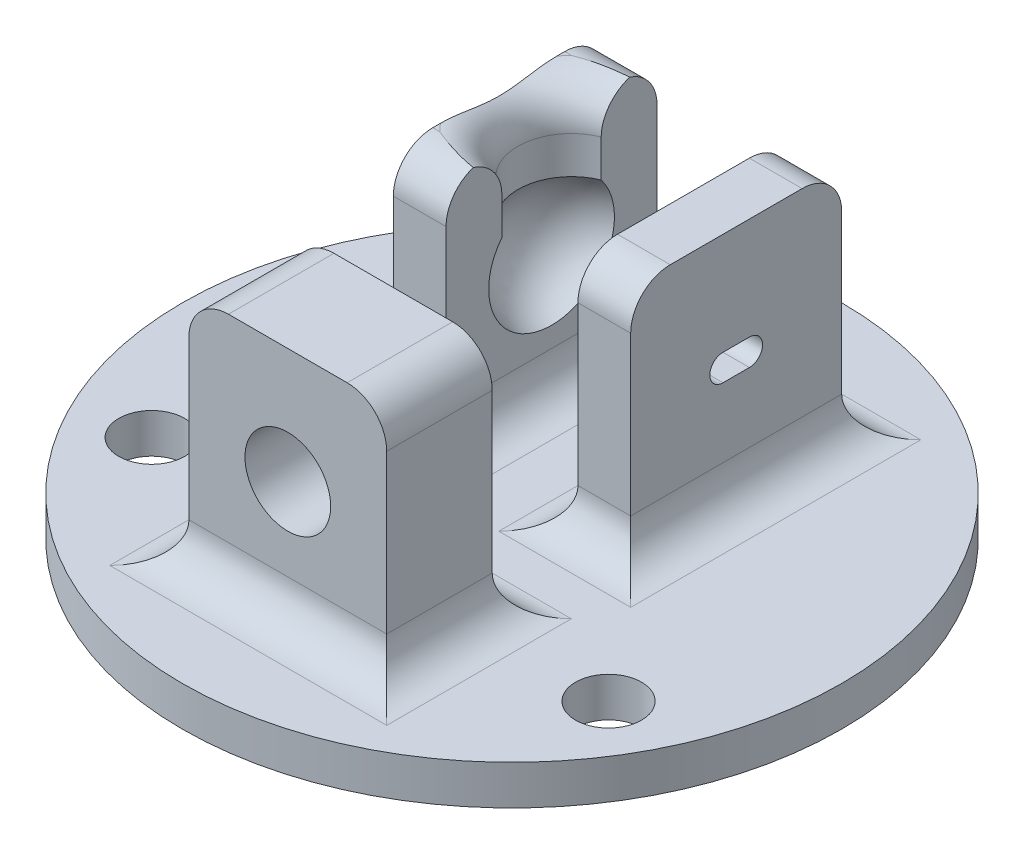
from build123d import *

# Parameters (mm, degrees)
BOSS_EXTRUDE1_DEPTH      = 2
BOSS_EXTRUDE1_DEPTH_BACK = 1
SKETCH1_R                = 25
SKETCH1_R_2              = 2.5
SKETCH2_W                = 4
SKETCH2_H                = 16
BOSS_EXTRUDE2_DEPTH      = 18
SKETCH3_R                = 5.75
CUT_EXTRUDE1_DEPTH       = 1.5
CUT_REVOLVE1_ANGLE       = 180
CUT_EXTRUDE2_REACH       = 43.122
CUT_EXTRUDE3_REACH       = 46.914
FILLET1_R                = 3
SKETCH7_W                = 15
SKETCH7_H                = 8
BOSS_EXTRUDE3_DEPTH      = 18
CUT_EXTRUDE4_REACH       = 54.811
SKETCH8_R                = 3.25
BOSS_EXTRUDE4_START      = -1
SKETCH9_R                = 3.25
SKETCH9_R_2              = 2.25
BOSS_EXTRUDE4_DEPTH      = 1
FILLET2_R                = 3


with BuildPart() as part:
    # Sketch1 → Boss-Extrude1 (new, two sides: drawn at the far end of the back side and taken through both)
    with BuildSketch(Plane(origin=(0, 0, 0), x_dir=(1, 0, 0), z_dir=(0, 1, 0)).offset(-BOSS_EXTRUDE1_DEPTH_BACK)):
        with Locations(Location((0, 0, 0), (0, 0, 270))):
            Circle(SKETCH1_R)
        with Locations(Location((0, 20, 0), (0, 0, 270))):
            Circle(SKETCH1_R_2, mode=Mode.SUBTRACT)
        with Locations(Location((17.320508076, -10, 0), (0, 0, 270))):
            Circle(SKETCH1_R_2, mode=Mode.SUBTRACT)
        with Locations(Location((-17.320508076, -10, 0), (0, 0, 270))):
            Circle(SKETCH1_R_2, mode=Mode.SUBTRACT)
    extrude(amount=BOSS_EXTRUDE1_DEPTH + BOSS_EXTRUDE1_DEPTH_BACK)

    # Sketch2 → Boss-Extrude2 (add)
    with BuildSketch(Plane(origin=(0, 2, 0), x_dir=(1, 0, 0), z_dir=(0, 1, 0))):
        with Locations((7, 8)):
            Rectangle(SKETCH2_W, SKETCH2_H)
        with Locations((-7, 8)):
            Rectangle(SKETCH2_W, SKETCH2_H)
    extrude(amount=BOSS_EXTRUDE2_DEPTH)

    # Sketch3 → Cut-Extrude1 (cut)
    with BuildSketch(Plane.ZY.offset(-5)):
        with Locations((-8, 11.25)):
            Circle(SKETCH3_R)
    extrude(amount=-CUT_EXTRUDE1_DEPTH, mode=Mode.SUBTRACT)

    # Sketch4 → Cut-Revolve1 (revolve, cut)
    with BuildSketch(Plane.ZY.offset(3.5)):
        with BuildLine():
            Line((-3.000039219, 11.269803747), (-12.999960781, 11.269803747))
            ThreePointArc((-12.999960781, 11.269803747), (-8, 16.25), (-3.000039219, 11.269803747))
        make_face()
    revolve(axis=Axis((-3.5, 11.269803747, -3.000039219), (0, 0, 1)), revolution_arc=CUT_REVOLVE1_ANGLE, mode=Mode.SUBTRACT)

    # Sketch5 → Cut-Extrude2 (cut, up to next)
    with BuildSketch(Plane(origin=(0, 20, 0), x_dir=(1, 0, 0), z_dir=(0, 1, 0)), mode=Mode.PRIVATE) as cut_extrude2_sk1:
        with BuildLine():
            Line((-5, 11.763417337), (-5, 4.230303993))
            ThreePointArc((-5, 4.230303993), (-7.554250753, 7.996860665), (-5, 11.763417337))
        make_face()
    cut_extrude2_tool1 = extrude(cut_extrude2_sk1.sketch, amount=-CUT_EXTRUDE2_REACH, mode=Mode.PRIVATE) & part.part
    add(cut_extrude2_tool1.solids().sort_by_distance((-6.055552, 20, -7.996861))[0], mode=Mode.SUBTRACT)

    # Sketch6 → Cut-Extrude3 (cut, up to next)
    with BuildSketch(Plane.ZY.offset(-6.5), mode=Mode.PRIVATE) as cut_extrude3_sk1:
        with BuildLine():
            Line((-9, 12.25), (-7, 12.25))
            ThreePointArc((-7, 12.25), (-6, 11.25), (-7, 10.25))
            Line((-7, 10.25), (-9, 10.25))
            ThreePointArc((-9, 10.25), (-10, 11.25), (-9, 12.25))
        make_face()
    cut_extrude3_tool1 = extrude(cut_extrude3_sk1.sketch, amount=-CUT_EXTRUDE3_REACH, mode=Mode.PRIVATE) & part.part
    add(cut_extrude3_tool1.solids().sort_by_distance((6.5, 11.25, -8))[0], mode=Mode.SUBTRACT)

    # Fillet1
    # the kernel refuses this fillet: 3 mm, written as the material it adds along each edge
    with BuildSketch(Plane(origin=(5, 2, -16), x_dir=(0, 0, -1), z_dir=(1, 0, 0)), Plane(origin=(-9, 2, -16), x_dir=(0, 0, -1), z_dir=(1, 0, 0)), Plane(origin=(9, 2, 0), x_dir=(0, 0, 1), z_dir=(-1, 0, 0)), Plane(origin=(-5, 2, 0), x_dir=(0, 0, 1), z_dir=(-1, 0, 0))) as fillet1_piece_1:
        with BuildLine():
            CenterArc((FILLET1_R, FILLET1_R), FILLET1_R, 180, 90)
            Line((0, FILLET1_R), (0, 0))
            Line((0, 0), (FILLET1_R, 0))
        make_face()
    extrude(amount=4)
    with BuildSketch(Plane(origin=(9, 2, -16), x_dir=(1, 0, 0), z_dir=(0, 0, 1)), Plane(origin=(5, 2, 0), x_dir=(-1, 0, 0), z_dir=(0, 0, -1)), Plane(origin=(-5, 2, -16), x_dir=(1, 0, 0), z_dir=(0, 0, 1)), Plane(origin=(-9, 2, 0), x_dir=(-1, 0, 0), z_dir=(0, 0, -1))) as fillet1_piece_2:
        with BuildLine():
            CenterArc((FILLET1_R, FILLET1_R), FILLET1_R, 180, 90)
            Line((0, FILLET1_R), (0, 0))
            Line((0, 0), (FILLET1_R, 0))
        make_face()
    extrude(amount=16)
    with BuildSketch(Plane(origin=(-2.5, 2, -16), x_dir=(0, 0, -1), z_dir=(1, 0, 0))) as fillet1_piece_3a_section:
        with BuildLine():
            CenterArc((FILLET1_R, FILLET1_R), FILLET1_R, 180, 90)
            Line((0, FILLET1_R), (0, 0))
            Line((0, 0), (FILLET1_R, 0))
        make_face()
    fillet1_piece_3a = extrude(amount=11.5, mode=Mode.PRIVATE)
    fillet1_piece_3a = fillet1_piece_3a - Plane(origin=(0, 2.708264554, -20), x_dir=(0, 0, 1), z_dir=(0, -1, 0)) * Cylinder(2.5, 35, mode=Mode.PRIVATE)
    fillet1_piece_3a = split(fillet1_piece_3a, bisect_by=Plane(origin=(5, 2.708264554, -16.611938718), z_dir=(-1, 0, 0)), keep=Keep.TOP, mode=Mode.PRIVATE)
    with BuildSketch(Plane(origin=(5, 2, 0), x_dir=(-1, 0, 0), z_dir=(0, 0, -1))) as fillet1_piece_3b_section:
        with BuildLine():
            CenterArc((FILLET1_R, FILLET1_R), FILLET1_R, 180, 90)
            Line((0, FILLET1_R), (0, 0))
            Line((0, 0), (FILLET1_R, 0))
        make_face()
    fillet1_piece_3b = extrude(amount=23.5, mode=Mode.PRIVATE)
    fillet1_piece_3b = fillet1_piece_3b - Plane(origin=(0, 2.682108515, -20), x_dir=(0, 0, 1), z_dir=(0, -1, 0)) * Cylinder(2.5, 59, mode=Mode.PRIVATE)
    fillet1_piece_3b = split(fillet1_piece_3b, bisect_by=Plane(origin=(4.329541602, 2.682108515, -16), z_dir=(0, 0, -1)), keep=Keep.TOP, mode=Mode.PRIVATE)
    fillet1_piece_3 = fillet1_piece_3a & fillet1_piece_3b
    add(fillet1_piece_3)
    with BuildSketch(Plane(origin=(9, 2, -23.5), x_dir=(1, 0, 0), z_dir=(0, 0, 1))) as fillet1_piece_4a_section:
        with BuildLine():
            CenterArc((FILLET1_R, FILLET1_R), FILLET1_R, 180, 90)
            Line((0, FILLET1_R), (0, 0))
            Line((0, 0), (FILLET1_R, 0))
        make_face()
    fillet1_piece_4a = extrude(amount=23.5, mode=Mode.PRIVATE)
    fillet1_piece_4a = fillet1_piece_4a & Plane(origin=(0, 2.69431261, 0), x_dir=(0, 0, 1), z_dir=(0, -1, 0)) * Cylinder(25, 59, mode=Mode.PRIVATE)
    fillet1_piece_4a = split(fillet1_piece_4a, bisect_by=Plane(origin=(9.653084962, 2.69431261, -16), z_dir=(0, 0, -1)), keep=Keep.TOP, mode=Mode.PRIVATE)
    with BuildSketch(Plane(origin=(5, 2, -16), x_dir=(0, 0, -1), z_dir=(1, 0, 0))) as fillet1_piece_4b_section:
        with BuildLine():
            CenterArc((FILLET1_R, FILLET1_R), FILLET1_R, 180, 90)
            Line((0, FILLET1_R), (0, 0))
            Line((0, 0), (FILLET1_R, 0))
        make_face()
    fillet1_piece_4b = extrude(amount=11.5, mode=Mode.PRIVATE)
    fillet1_piece_4b = fillet1_piece_4b & Plane(origin=(0, 2.679254462, 0), x_dir=(0, 0, 1), z_dir=(0, -1, 0)) * Cylinder(25, 35, mode=Mode.PRIVATE)
    fillet1_piece_4b = split(fillet1_piece_4b, bisect_by=Plane(origin=(9, 2.679254462, -16.678966139), z_dir=(1, 0, 0)), keep=Keep.TOP, mode=Mode.PRIVATE)
    fillet1_piece_4 = fillet1_piece_4a & fillet1_piece_4b
    add(fillet1_piece_4)
    with BuildSketch(Plane(origin=(9, 2, -16), x_dir=(1, 0, 0), z_dir=(0, 0, 1))) as fillet1_piece_5a_section:
        with BuildLine():
            CenterArc((FILLET1_R, FILLET1_R), FILLET1_R, 180, 90)
            Line((0, FILLET1_R), (0, 0))
            Line((0, 0), (FILLET1_R, 0))
        make_face()
    fillet1_piece_5a = extrude(amount=23.5, mode=Mode.PRIVATE)
    fillet1_piece_5a = split(fillet1_piece_5a, bisect_by=Plane(origin=(9.679185343, 2.679185343, 0), z_dir=(0, 0, 1)), keep=Keep.TOP, mode=Mode.PRIVATE)
    with BuildSketch(Plane(origin=(16.5, 2, 0), x_dir=(0, 0, 1), z_dir=(-1, 0, 0))) as fillet1_piece_5b_section:
        with BuildLine():
            CenterArc((FILLET1_R, FILLET1_R), FILLET1_R, 180, 90)
            Line((0, FILLET1_R), (0, 0))
            Line((0, 0), (FILLET1_R, 0))
        make_face()
    fillet1_piece_5b = extrude(amount=11.5, mode=Mode.PRIVATE)
    fillet1_piece_5b = split(fillet1_piece_5b, bisect_by=Plane(origin=(9, 2.679185343, 0.679185343), z_dir=(1, 0, 0)), keep=Keep.TOP, mode=Mode.PRIVATE)
    fillet1_piece_5 = fillet1_piece_5a & fillet1_piece_5b
    add(fillet1_piece_5)
    with BuildSketch(Plane(origin=(5, 2, 7.5), x_dir=(-1, 0, 0), z_dir=(0, 0, -1))) as fillet1_piece_6a_section:
        with BuildLine():
            CenterArc((FILLET1_R, FILLET1_R), FILLET1_R, 180, 90)
            Line((0, FILLET1_R), (0, 0))
            Line((0, 0), (FILLET1_R, 0))
        make_face()
    fillet1_piece_6a = extrude(amount=23.5, mode=Mode.PRIVATE)
    fillet1_piece_6a = split(fillet1_piece_6a, bisect_by=Plane(origin=(4.320814657, 2.679185343, 0), z_dir=(0, 0, 1)), keep=Keep.TOP, mode=Mode.PRIVATE)
    with BuildSketch(Plane(origin=(9, 2, 0), x_dir=(0, 0, 1), z_dir=(-1, 0, 0))) as fillet1_piece_6b_section:
        with BuildLine():
            CenterArc((FILLET1_R, FILLET1_R), FILLET1_R, 180, 90)
            Line((0, FILLET1_R), (0, 0))
            Line((0, 0), (FILLET1_R, 0))
        make_face()
    fillet1_piece_6b = extrude(amount=11.5, mode=Mode.PRIVATE)
    fillet1_piece_6b = split(fillet1_piece_6b, bisect_by=Plane(origin=(5, 2.679185343, 0.679185343), z_dir=(-1, 0, 0)), keep=Keep.TOP, mode=Mode.PRIVATE)
    fillet1_piece_6 = fillet1_piece_6a & fillet1_piece_6b
    add(fillet1_piece_6)
    with BuildSketch(Plane(origin=(-9, 2, 0), x_dir=(-1, 0, 0), z_dir=(0, 0, -1))) as fillet1_piece_7a_section:
        with BuildLine():
            CenterArc((FILLET1_R, FILLET1_R), FILLET1_R, 180, 90)
            Line((0, FILLET1_R), (0, 0))
            Line((0, 0), (FILLET1_R, 0))
        make_face()
    fillet1_piece_7a = extrude(amount=23.5, mode=Mode.PRIVATE)
    fillet1_piece_7a = fillet1_piece_7a & Plane(origin=(0, 2.694311591, 0), x_dir=(0, 0, 1), z_dir=(0, -1, 0)) * Cylinder(25, 59, mode=Mode.PRIVATE)
    fillet1_piece_7a = split(fillet1_piece_7a, bisect_by=Plane(origin=(-9.653081328, 2.694311591, -16), z_dir=(0, 0, -1)), keep=Keep.TOP, mode=Mode.PRIVATE)
    with BuildSketch(Plane(origin=(-16.5, 2, -16), x_dir=(0, 0, -1), z_dir=(1, 0, 0))) as fillet1_piece_7b_section:
        with BuildLine():
            CenterArc((FILLET1_R, FILLET1_R), FILLET1_R, 180, 90)
            Line((0, FILLET1_R), (0, 0))
            Line((0, 0), (FILLET1_R, 0))
        make_face()
    fillet1_piece_7b = extrude(amount=11.5, mode=Mode.PRIVATE)
    fillet1_piece_7b = fillet1_piece_7b & Plane(origin=(0, 2.679254462, 0), x_dir=(0, 0, 1), z_dir=(0, -1, 0)) * Cylinder(25, 35, mode=Mode.PRIVATE)
    fillet1_piece_7b = split(fillet1_piece_7b, bisect_by=Plane(origin=(-9, 2.679254462, -16.678966139), z_dir=(-1, 0, 0)), keep=Keep.TOP, mode=Mode.PRIVATE)
    fillet1_piece_7 = fillet1_piece_7a & fillet1_piece_7b
    add(fillet1_piece_7)
    with BuildSketch(Plane(origin=(-5, 2, -23.5), x_dir=(1, 0, 0), z_dir=(0, 0, 1))) as fillet1_piece_8a_section:
        with BuildLine():
            CenterArc((FILLET1_R, FILLET1_R), FILLET1_R, 180, 90)
            Line((0, FILLET1_R), (0, 0))
            Line((0, 0), (FILLET1_R, 0))
        make_face()
    fillet1_piece_8a = extrude(amount=23.5, mode=Mode.PRIVATE)
    fillet1_piece_8a = fillet1_piece_8a - Plane(origin=(0, 2.682108515, -20), x_dir=(0, 0, 1), z_dir=(0, -1, 0)) * Cylinder(2.5, 59, mode=Mode.PRIVATE)
    fillet1_piece_8a = split(fillet1_piece_8a, bisect_by=Plane(origin=(-4.329541602, 2.682108515, -16), z_dir=(0, 0, -1)), keep=Keep.TOP, mode=Mode.PRIVATE)
    with BuildSketch(Plane(origin=(-9, 2, -16), x_dir=(0, 0, -1), z_dir=(1, 0, 0))) as fillet1_piece_8b_section:
        with BuildLine():
            CenterArc((FILLET1_R, FILLET1_R), FILLET1_R, 180, 90)
            Line((0, FILLET1_R), (0, 0))
            Line((0, 0), (FILLET1_R, 0))
        make_face()
    fillet1_piece_8b = extrude(amount=11.5, mode=Mode.PRIVATE)
    fillet1_piece_8b = fillet1_piece_8b - Plane(origin=(0, 2.708264539, -20), x_dir=(0, 0, 1), z_dir=(0, -1, 0)) * Cylinder(2.5, 35, mode=Mode.PRIVATE)
    fillet1_piece_8b = split(fillet1_piece_8b, bisect_by=Plane(origin=(-5, 2.708264539, -16.61193878), z_dir=(1, 0, 0)), keep=Keep.TOP, mode=Mode.PRIVATE)
    fillet1_piece_8 = fillet1_piece_8a & fillet1_piece_8b
    add(fillet1_piece_8)
    with BuildSketch(Plane(origin=(2.5, 2, 0), x_dir=(0, 0, 1), z_dir=(-1, 0, 0))) as fillet1_piece_9a_section:
        with BuildLine():
            CenterArc((FILLET1_R, FILLET1_R), FILLET1_R, 180, 90)
            Line((0, FILLET1_R), (0, 0))
            Line((0, 0), (FILLET1_R, 0))
        make_face()
    fillet1_piece_9a = extrude(amount=11.5, mode=Mode.PRIVATE)
    fillet1_piece_9a = split(fillet1_piece_9a, bisect_by=Plane(origin=(-5, 2.679185343, 0.679185343), z_dir=(1, 0, 0)), keep=Keep.TOP, mode=Mode.PRIVATE)
    with BuildSketch(Plane(origin=(-5, 2, -16), x_dir=(1, 0, 0), z_dir=(0, 0, 1))) as fillet1_piece_9b_section:
        with BuildLine():
            CenterArc((FILLET1_R, FILLET1_R), FILLET1_R, 180, 90)
            Line((0, FILLET1_R), (0, 0))
            Line((0, 0), (FILLET1_R, 0))
        make_face()
    fillet1_piece_9b = extrude(amount=23.5, mode=Mode.PRIVATE)
    fillet1_piece_9b = split(fillet1_piece_9b, bisect_by=Plane(origin=(-4.320814657, 2.679185343, 0), z_dir=(0, 0, 1)), keep=Keep.TOP, mode=Mode.PRIVATE)
    fillet1_piece_9 = fillet1_piece_9a & fillet1_piece_9b
    add(fillet1_piece_9)
    with BuildSketch(Plane(origin=(-9, 2, 7.5), x_dir=(-1, 0, 0), z_dir=(0, 0, -1))) as fillet1_piece_10a_section:
        with BuildLine():
            CenterArc((FILLET1_R, FILLET1_R), FILLET1_R, 180, 90)
            Line((0, FILLET1_R), (0, 0))
            Line((0, 0), (FILLET1_R, 0))
        make_face()
    fillet1_piece_10a = extrude(amount=23.5, mode=Mode.PRIVATE)
    fillet1_piece_10a = split(fillet1_piece_10a, bisect_by=Plane(origin=(-9.679185343, 2.679185343, 0), z_dir=(0, 0, 1)), keep=Keep.TOP, mode=Mode.PRIVATE)
    with BuildSketch(Plane(origin=(-5, 2, 0), x_dir=(0, 0, 1), z_dir=(-1, 0, 0))) as fillet1_piece_10b_section:
        with BuildLine():
            CenterArc((FILLET1_R, FILLET1_R), FILLET1_R, 180, 90)
            Line((0, FILLET1_R), (0, 0))
            Line((0, 0), (FILLET1_R, 0))
        make_face()
    fillet1_piece_10b = extrude(amount=11.5, mode=Mode.PRIVATE)
    fillet1_piece_10b = split(fillet1_piece_10b, bisect_by=Plane(origin=(-9, 2.679185343, 0.679185343), z_dir=(-1, 0, 0)), keep=Keep.TOP, mode=Mode.PRIVATE)
    fillet1_piece_10 = fillet1_piece_10a & fillet1_piece_10b
    add(fillet1_piece_10)
    # the kernel refuses this fillet: 3 mm, written as the material it takes off along each edge
    with BuildSketch(Plane(origin=(-3.5, 20, -7.996860665), x_dir=(0.9951857838683703, 0, 0.09800640584317669), z_dir=(0.09800640584317669, 0, -0.9951857838683703))) as fillet1_2_piece_1:
        with BuildLine():
            CenterArc((4.054250753 + FILLET1_R, FILLET1_R), FILLET1_R, 180, 90)
            Line((4.054250753, FILLET1_R), (4.054250753, 0))
            Line((4.054250753, 0), (4.054250753 + FILLET1_R, 0))
        make_face()
    revolve(axis=Axis((-3.5, 20, -7.996860665), (0, -1, 0)), revolution_arc=348.751236033, mode=Mode.SUBTRACT)
    with BuildSketch(Plane(origin=(-16.5, 20, -16), x_dir=(0, -1, 0), z_dir=(1, 0, 0)), Plane(origin=(2.5, 20, 0), x_dir=(0, -1, 0), z_dir=(-1, 0, 0)), Plane(origin=(-2.5, 20, -16), x_dir=(0, -1, 0), z_dir=(1, 0, 0)), Plane(origin=(16.5, 20, 0), x_dir=(0, -1, 0), z_dir=(-1, 0, 0))) as fillet1_2_piece_2:
        with BuildLine():
            CenterArc((FILLET1_R, -FILLET1_R), FILLET1_R, 90, 90)
            Line((0, -FILLET1_R), (0, 0))
            Line((0, 0), (FILLET1_R, 0))
        make_face()
    extrude(amount=19, mode=Mode.SUBTRACT)

    # Sketch7 → Boss-Extrude3 (add)
    with BuildSketch(Plane(origin=(0, 2, 0), x_dir=(1, 0, 0), z_dir=(0, 1, 0))):
        with Locations((0, -13)):
            Rectangle(SKETCH7_W, SKETCH7_H)
    extrude(amount=BOSS_EXTRUDE3_DEPTH)

    # Sketch8 → Cut-Extrude4 (cut, up to next)
    with BuildSketch(Plane.XY.offset(17), mode=Mode.PRIVATE) as cut_extrude4_sk1:
        with Locations((0, 11.25)):
            Circle(SKETCH8_R)
    cut_extrude4_tool1 = extrude(cut_extrude4_sk1.sketch, amount=-CUT_EXTRUDE4_REACH, mode=Mode.PRIVATE) & part.part
    add(cut_extrude4_tool1.solids().sort_by_distance((0, 11.25, 17))[0], mode=Mode.SUBTRACT)

    # Sketch9 → Boss-Extrude4 (add)
    with BuildSketch(Plane(origin=(0, 0, 9), x_dir=(-1, 0, 0), z_dir=(0, 0, -1)).offset(BOSS_EXTRUDE4_START)):
        with Locations(Location((0, 11.25, 0), (0, 0, 180))):
            Circle(SKETCH9_R)
        with Locations((0, 11.25)):
            Circle(SKETCH9_R_2, mode=Mode.SUBTRACT)
    extrude(amount=BOSS_EXTRUDE4_DEPTH)

    # Fillet2
    fillet2_edges = [part.edges().sort_by_distance(p)[0] for p in [
        (-7.5, 2, 13),
        (0, 2, 17),
        (7.5, 2, 13),
        (0, 2, 9),
        (-7.5, 20, 13),
        (7.5, 20, 13),
    ]]
    fillet(fillet2_edges, radius=FILLET2_R)


solid = part.part
